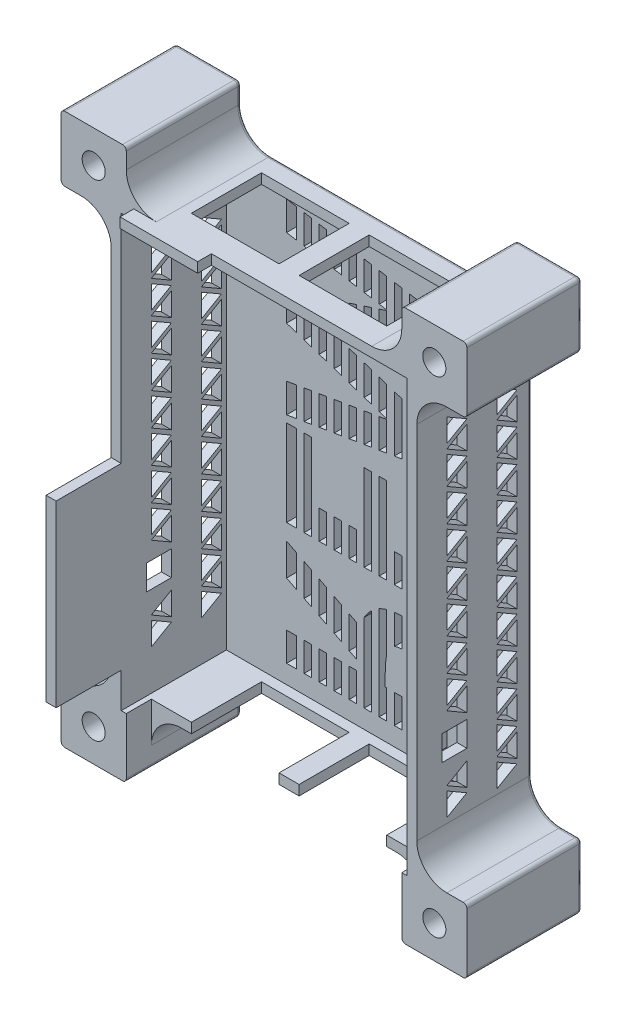
from build123d import *

# Parameters (mm, degrees)
SKETCH1_W            = 61
SKETCH1_H            = 90
BOSS_EXTRUDE1_DEPTH  = 4
SKETCH2_W            = 57
SKETCH2_H            = 86
CUT_EXTRUDE1_DEPTH   = 2
SKETCH3_W            = 61
SKETCH3_H            = 90
SKETCH3_W_2          = 57
SKETCH3_H_2          = 86
BOSS_EXTRUDE2_DEPTH  = 14
BOSS_EXTRUDE3_DEPTH  = 5
SKETCH5_W            = 17.5
SKETCH5_H            = 14
CUT_EXTRUDE2_DEPTH   = 5
SKETCH6_W            = 17.5
SKETCH6_H            = 14
CUT_EXTRUDE3_DEPTH   = 5
SKETCH7_W            = 2
SKETCH7_H            = 35.75
BOSS_EXTRUDE4_DEPTH  = 13
SKETCH8_W            = 5
SKETCH8_H            = 5
CUT_EXTRUDE4_DEPTH   = 115.529472189
CUT_EXTRUDE5_DEPTH   = 2
SKETCH16_W           = 15.5
SKETCH16_H           = 2
BOSS_EXTRUDE9_DEPTH  = 2.75
SKETCH22_W           = 1.5
SKETCH22_H           = 90
BOSS_EXTRUDE11_DEPTH = 2
FILLET5_R            = 0.75
BOSS_EXTRUDE13_START = -23
SKETCH36_W           = 13
SKETCH36_H           = 13
BOSS_EXTRUDE13_DEPTH = 23
SKETCH37_W           = 13
SKETCH37_H           = 13
BOSS_EXTRUDE14_DEPTH = 23
SKETCH41_W           = 1
SKETCH41_H           = 1
CUT_EXTRUDE13_DEPTH  = 21
SKETCH49_W           = 57.25
SKETCH49_H           = 0.75
BOSS_EXTRUDE15_DEPTH = 1
FILLET8_R            = 6
FILLET9_R            = 6
FILLET10_R           = 6
FILLET11_R           = 6
SKETCH46_R           = 2.3
CUT_EXTRUDE18_DEPTH  = 128.816274528
SKETCH50_W           = 5.5
SKETCH50_H           = 2.75
CUT_EXTRUDE19_DEPTH  = 128.816274528
BOSS_EXTRUDE16_DEPTH = 23
SKETCH52_R           = 2.3
CUT_EXTRUDE20_DEPTH  = 128.816274528
FILLET13_R           = 6
FILLET14_R           = 6
FILLET15_R           = 6
FILLET16_R           = 6
FILLET18_R           = 0.75


with BuildPart() as part:
    # Sketch1 → Boss-Extrude1 (new body)
    with BuildSketch(Plane.XY):
        with Locations((30.5, 45)):
            Rectangle(SKETCH1_W, SKETCH1_H)
    extrude(amount=BOSS_EXTRUDE1_DEPTH)

    # Sketch2 → Cut-Extrude1 (cut)
    with BuildSketch(Plane.XY.offset(4)):
        with Locations((30.5, 45)):
            Rectangle(SKETCH2_W, SKETCH2_H)
    extrude(amount=-CUT_EXTRUDE1_DEPTH, mode=Mode.SUBTRACT)

    # Sketch3 → Boss-Extrude2 (add)
    with BuildSketch(Plane.XY.offset(4)):
        with Locations((30.5, 45)):
            Rectangle(SKETCH3_W, SKETCH3_H)
        with Locations((30.5, 45)):
            Rectangle(SKETCH3_W_2, SKETCH3_H_2, mode=Mode.SUBTRACT)
    extrude(amount=BOSS_EXTRUDE2_DEPTH)

    # Sketch4 → Boss-Extrude3 (add)
    with BuildSketch(Plane.XY.offset(18)):
        Polygon((2, 2), (2, 88), (59, 88), (59, 2), (61, 2), (61, 90), (0, 90), (0, 2), align=None)
    extrude(amount=BOSS_EXTRUDE3_DEPTH)

    # Sketch5 → Cut-Extrude2 (cut)
    with BuildSketch(Plane(origin=(0, 0, 0), x_dir=(-1, 0, 0), z_dir=(0, -1, 0))):
        with Locations((-19.75, -11)):
            Rectangle(SKETCH5_W, SKETCH5_H)
        with Locations((-41.25, -11)):
            Rectangle(SKETCH5_W, SKETCH5_H)
    extrude(amount=-CUT_EXTRUDE2_DEPTH, mode=Mode.SUBTRACT)

    # Sketch6 → Cut-Extrude3 (cut)
    with BuildSketch(Plane(origin=(0, 90, 0), x_dir=(1, 0, 0), z_dir=(0, 1, 0))):
        with Locations((41.25, -11)):
            Rectangle(SKETCH6_W, SKETCH6_H)
        with Locations((19.75, -11)):
            Rectangle(SKETCH6_W, SKETCH6_H)
    extrude(amount=-CUT_EXTRUDE3_DEPTH, mode=Mode.SUBTRACT)

    # Sketch7 → Boss-Extrude4 (add)
    with BuildSketch(Plane.XY.offset(23)):
        with Locations((1, 26.875)):
            Rectangle(SKETCH7_W, SKETCH7_H)
    extrude(amount=BOSS_EXTRUDE4_DEPTH)

    # Sketch8 → Cut-Extrude4 (cut, through all)
    with BuildSketch(Plane(origin=(61, 0, 0), x_dir=(0, 0, -1), z_dir=(1, 0, 0))):
        Polygon((-13, 17.85196366), (-13, 13.233161507), (-17, 15.542562584), align=None)
        with Locations((-15.5, 22.5)):
            Rectangle(SKETCH8_W, SKETCH8_H)
        Polygon((-3, 12.309401077), (-7, 10), (-7, 14.618802154), align=None)
        Polygon((-3, 13.233161507), (-7, 15.542562584), (-3, 17.85196366), align=None)
        Polygon((-17, 14.618802154), (-13, 12.309401077), (-17, 10), align=None)
        Polygon((-13, 30.784609687), (-13, 26.165807534), (-17, 28.475208611), align=None)
        Polygon((-13, 37.250932701), (-13, 32.632130547), (-17, 34.941531624), align=None)
        Polygon((-17, 34.017771194), (-13, 31.708370117), (-17, 29.398969041), align=None)
        Polygon((-13, 43.717255714), (-13, 39.098453561), (-17, 41.407854638), align=None)
        Polygon((-17, 40.484094208), (-13, 38.174693131), (-17, 35.865292054), align=None)
        Polygon((-13, 50.183578728), (-13, 45.564776574), (-17, 47.874177651), align=None)
        Polygon((-17, 46.950417221), (-13, 44.641016144), (-17, 42.331615068), align=None)
        Polygon((-13, 56.649901741), (-13, 52.031099588), (-17, 54.340500665), align=None)
        Polygon((-17, 53.416740235), (-13, 51.107339158), (-17, 48.797938081), align=None)
        Polygon((-13, 63.116224755), (-13, 58.497422601), (-17, 60.806823678), align=None)
        Polygon((-17, 59.883063248), (-13, 57.573662171), (-17, 55.264261095), align=None)
        Polygon((-13, 69.582547768), (-13, 64.963745615), (-17, 67.273146692), align=None)
        Polygon((-17, 66.349386262), (-13, 64.039985185), (-17, 61.730584108), align=None)
        Polygon((-13, 76.048870782), (-13, 71.430068628), (-17, 73.739469705), align=None)
        Polygon((-17, 72.815709275), (-13, 70.506308198), (-17, 68.196907122), align=None)
        Polygon((-17, 79.282032289), (-13, 76.972631212), (-17, 74.663230135), align=None)
        Polygon((-3, 24.318286674), (-3, 19.69948452), (-7, 22.008885597), align=None)
        Polygon((-7, 21.085125167), (-3, 18.77572409), (-7, 16.466323014), align=None)
        Polygon((-3, 30.784609687), (-3, 26.165807534), (-7, 28.475208611), align=None)
        Polygon((-7, 27.551448181), (-3, 25.242047104), (-7, 22.932646027), align=None)
        Polygon((-3, 37.250932701), (-3, 32.632130547), (-7, 34.941531624), align=None)
        Polygon((-7, 34.017771194), (-3, 31.708370117), (-7, 29.398969041), align=None)
        Polygon((-3, 43.717255714), (-3, 39.098453561), (-7, 41.407854638), align=None)
        Polygon((-7, 40.484094208), (-3, 38.174693131), (-7, 35.865292054), align=None)
        Polygon((-3, 50.183578728), (-3, 45.564776574), (-7, 47.874177651), align=None)
        Polygon((-7, 46.950417221), (-3, 44.641016144), (-7, 42.331615068), align=None)
        Polygon((-3, 56.649901741), (-3, 52.031099588), (-7, 54.340500665), align=None)
        Polygon((-7, 53.416740235), (-3, 51.107339158), (-7, 48.797938081), align=None)
        Polygon((-3, 63.116224755), (-3, 58.497422601), (-7, 60.806823678), align=None)
        Polygon((-7, 59.883063248), (-3, 57.573662171), (-7, 55.264261095), align=None)
        Polygon((-3, 69.582547768), (-3, 64.963745615), (-7, 67.273146692), align=None)
        Polygon((-7, 66.349386262), (-3, 64.039985185), (-7, 61.730584108), align=None)
        Polygon((-3, 76.048870782), (-3, 71.430068628), (-7, 73.739469705), align=None)
        Polygon((-7, 72.815709275), (-3, 70.506308198), (-7, 68.196907122), align=None)
        Polygon((-7, 79.282032289), (-3, 76.972631212), (-7, 74.663230135), align=None)
    extrude(amount=-CUT_EXTRUDE4_DEPTH, mode=Mode.SUBTRACT)

    # Sketch9 → Cut-Extrude5 (cut)
    # profile 1 of 3: a face of its own
    with BuildSketch(Plane(origin=(-13.266512167, 62.494438007, 0), x_dir=(0, 1, 0), z_dir=(0, 0, -1))):
        with BuildLine():
            Line((-56.802130315, 59.266512167), (-50.109822622, 59.266512167))
            add(Edge.make_bspline(
                [(-50.109822622, 59.266512167), (-49.667463121, 59.264942045), (-48.816681194, 59.261922257), (-47.589900124, 59.214278008), (-46.462933001, 59.147977126), (-45.434111249, 59.046800219), (-44.503875014, 58.912651871), (-43.671291982, 58.754513167), (-42.93638649, 58.574280209), (-42.292960623, 58.349695725), (-41.712300595, 58.096367831), (-41.171044722, 57.805289436), (-40.657252094, 57.479701789), (-40.17435686, 57.111037799), (-39.718162547, 56.70592964), (-39.287808517, 56.26396953), (-38.889376072, 55.78140983), (-38.52533232, 55.261299705), (-38.193535744, 54.71415578), (-37.900297161, 54.139226823), (-37.661835058, 53.53611301), (-37.451128227, 52.913530638), (-37.299362923, 52.262579771), (-37.193812374, 51.589597526), (-37.116532391, 50.892214933), (-37.112089162, 50.418444162), (-37.109822622, 50.176768577)],
                knots=[0, 0, 0, 0, 1.749336639, 3.364467119, 4.854658419, 6.213483162, 7.451590619, 8.570285859, 9.5643256, 10.440900261, 11.26203566, 12.067320669, 12.869050712, 13.665104639, 14.467235401, 15.27997916, 16.102287765, 16.939272006, 17.78853747, 18.631303466, 19.488103222, 20.351255419, 21.228522269, 22.127379805, 23.044756219, 24, 24, 24, 24], degree=3))
            add(Edge.make_bspline(
                [(-37.109822622, 50.176768577), (-37.115710277, 49.924514784), (-37.127254893, 49.429891072), (-37.18944048, 48.70332918), (-37.303096198, 48.008205583), (-37.475244317, 47.346555516), (-37.673106221, 46.710143974), (-37.936211798, 46.110713148), (-38.233152446, 45.539545183), (-38.585820178, 45.004719469), (-38.972855785, 44.494356457), (-39.422970054, 44.028010047), (-39.907002495, 43.580615886), (-40.452162334, 43.180197226), (-41.034418419, 42.799679204), (-41.665339566, 42.45482854), (-42.340808166, 42.136976483), (-42.815696044, 41.95972022), (-43.058540571, 41.869076269)],
                knots=[0, 0, 0, 0, 1.099860209, 2.156625411, 3.176576793, 4.16617041, 5.135385252, 6.078461593, 7.016046972, 7.938469504, 8.868247731, 9.803980173, 10.76021508, 11.73834243, 12.748633912, 13.790971185, 14.870363756, 16, 16, 16, 16], degree=3))
            Line((-43.058540571, 41.869076269), (-35.673925186, 27.266512167))
            Line((-35.673925186, 27.266512167), (-42.058540571, 27.266512167))
            Line((-42.058540571, 27.266512167), (-49.109822622, 41.215230116))
            Line((-49.109822622, 41.215230116), (-51.058540571, 41.215230116))
            Line((-51.058540571, 41.215230116), (-51.058540571, 27.266512167))
            Line((-51.058540571, 27.266512167), (-56.802130315, 27.266512167))
            Line((-56.802130315, 27.266512167), (-56.802130315, 59.266512167))
        make_face()
        with BuildLine():
            Line((-51.058540571, 46.958819859), (-48.821361084, 46.958819859))
            add(Edge.make_bspline(
                [(-48.821361084, 46.958819859), (-48.547847295, 46.961900355), (-48.02412716, 46.967798843), (-47.27094882, 46.995158476), (-46.586883264, 47.061081673), (-45.968992883, 47.144373167), (-45.414168509, 47.240545226), (-44.927358981, 47.378365626), (-44.501063305, 47.526043673), (-44.140333102, 47.709569177), (-43.832133506, 47.918277481), (-43.56602288, 48.155375302), (-43.345911237, 48.429785839), (-43.164748128, 48.734051799), (-43.023822925, 49.070864337), (-42.920958323, 49.436526017), (-42.863472222, 49.835202194), (-42.856858251, 50.110343042), (-42.853412366, 50.253691654)],
                knots=[0, 0, 0, 0, 1.688639943, 3.233382647, 4.650958383, 5.928841754, 7.082724185, 8.122798841, 9.049171256, 9.863274652, 10.613301712, 11.341792392, 12.054588806, 12.776240173, 13.521029143, 14.301969904, 15.115324896, 16, 16, 16, 16], degree=3))
            add(Edge.make_bspline(
                [(-42.853412366, 50.253691654), (-42.859927127, 50.423283527), (-42.872724168, 50.756415335), (-42.999710567, 51.236008328), (-43.201845485, 51.679904456), (-43.478917095, 52.086098086), (-43.827852765, 52.442195463), (-44.228283977, 52.756098136), (-44.688853003, 53.004308883), (-45.115305262, 53.168026048), (-45.503277138, 53.265979718), (-45.853409516, 53.338973926), (-46.258864918, 53.390707016), (-46.719949441, 53.445579167), (-47.235487763, 53.481160979), (-47.808289878, 53.50712861), (-48.436710703, 53.517753243), (-48.874779702, 53.521149751), (-49.103412366, 53.522922423)],
                knots=[0, 0, 0, 0, 1.020303359, 2.004196876, 2.966617323, 3.9489082, 4.950758222, 5.960522915, 7.003732012, 8.091992268, 8.70421221, 9.413913587, 10.24622431, 11.166358409, 12.212345909, 13.359657661, 14.621978493, 16, 16, 16, 16], degree=3))
            Line((-49.103412366, 53.522922423), (-51.058540571, 53.522922423))
            Line((-51.058540571, 53.522922423), (-51.058540571, 46.958819859))
        make_face(mode=Mode.SUBTRACT)
    # profile 2 of 3: a face of its own
    with BuildSketch(Plane(origin=(-13.266512167, 62.494438007, 0), x_dir=(0, 1, 0), z_dir=(0, 0, -1))):
        Polygon((-32.453412366, 59.266512167), (-15.222643135, 59.266512167), (-15.222643135, 53.522922423), (-26.709822622, 53.522922423), (-26.709822622, 47.369076269), (-15.222643135, 47.369076269), (-15.222643135, 41.625486526), (-26.709822622, 41.625486526), (-26.709822622, 33.01010191), (-15.222643135, 33.01010191), (-15.222643135, 27.266512167), (-32.453412366, 27.266512167), align=None)
    # profile 3 of 3: a face of its own
    with BuildSketch(Plane(origin=(-13.266512167, 62.494438007, 0), x_dir=(0, 1, 0), z_dir=(0, 0, -1))):
        Polygon((-8.444438007, 59.266512167), (-2.495720058, 59.266512167), (4.818382506, 36.945999346), (12.170946608, 59.266512167), (18.074792762, 59.266512167), (23.485049173, 27.266512167), (17.670946608, 27.266512167), (14.254279942, 47.478050628), (7.600433788, 27.266512167), (2.004279942, 27.266512167), (-4.61751493, 47.478050628), (-8.02777134, 27.266512167), (-13.848284161, 27.266512167), align=None)
    extrude(amount=-CUT_EXTRUDE5_DEPTH, mode=Mode.SUBTRACT)


with BuildPart() as cut_extrude5_piece_1:
    # of the separate pieces the step leaves, piece 1, a body of its own (cut_extrude5_pieces)
    add(part.part.solids().sort_by_distance((0, 0, 18))[0])

    # Sketch16 → Boss-Extrude9 (add)
    with BuildSketch(Plane.XY.offset(23)):
        with Locations((12.25, 89)):
            Rectangle(SKETCH16_W, SKETCH16_H)
    extrude(amount=BOSS_EXTRUDE9_DEPTH)



with BuildPart() as cut_extrude5_piece_2:
    # of the separate pieces the step leaves, piece 2, a body of its own (cut_extrude5_pieces)
    add(part.part.solids().sort_by_distance((33.692307692, 11.435897436, 0))[0])


with BuildPart() as cut_extrude5_piece_1_1:
    add(cut_extrude5_piece_1.part)

    add(cut_extrude5_piece_2.part)  # Boss-Extrude11 merges Cut-Extrude5 piece 2
    # Sketch22 → Boss-Extrude11 (add)
    with BuildSketch(Plane(origin=(0, 0, 0), x_dir=(-1, 0, 0), z_dir=(0, 0, -1))):
        with Locations((-25.75, 45)):
            Rectangle(SKETCH22_W, SKETCH22_H)
        with Locations((-28.75, 45)):
            Rectangle(SKETCH22_W, SKETCH22_H)
        with Locations((-22.75, 45)):
            Rectangle(SKETCH22_W, SKETCH22_H)
        with Locations((-19.75, 45)):
            Rectangle(SKETCH22_W, SKETCH22_H)
        with Locations((-16.75, 45)):
            Rectangle(SKETCH22_W, SKETCH22_H)
        with Locations((-31.75, 45)):
            Rectangle(SKETCH22_W, SKETCH22_H)
        with Locations((-34.75, 45)):
            Rectangle(SKETCH22_W, SKETCH22_H)
        with Locations((-37.75, 45)):
            Rectangle(SKETCH22_W, SKETCH22_H)
        with Locations((-40.75, 45)):
            Rectangle(SKETCH22_W, SKETCH22_H)
        with Locations((-43.75, 45)):
            Rectangle(SKETCH22_W, SKETCH22_H)
        with Locations((-46.75, 45)):
            Rectangle(SKETCH22_W, SKETCH22_H)
        with Locations((-49.75, 45)):
            Rectangle(SKETCH22_W, SKETCH22_H)
    extrude(amount=-BOSS_EXTRUDE11_DEPTH)

    # Fillet5
    fillet5_edges = [cut_extrude5_piece_1_1.edges().sort_by_distance(p)[0] for p in [
        (30.5, 0, 0),
        (30.5, 90, 0),
        (0, 0, 9),
        (61, 90, 11.5),
        (61, 45, 0),
        (61, 0, 9),
        (0, 45, 0),
        (0, 90, 11.5),
    ]]
    fillet(fillet5_edges, radius=FILLET5_R)

    # Sketch36 → Boss-Extrude13 (add)
    with BuildSketch(Plane(origin=(0, 0, 0), x_dir=(-1, 0, 0), z_dir=(0, 0, -1)).offset(BOSS_EXTRUDE13_START)):
        with Locations((-64.5, -3.5)):
            Rectangle(SKETCH36_W, SKETCH36_H)
    extrude(amount=BOSS_EXTRUDE13_DEPTH)

    # Sketch37 → Boss-Extrude14 (add)
    with BuildSketch(Plane(origin=(0, 0, 0), x_dir=(-1, 0, 0), z_dir=(0, 0, -1))):
        with Locations((3.5, 93.5)):
            Rectangle(SKETCH37_W, SKETCH37_H)
    extrude(amount=-BOSS_EXTRUDE14_DEPTH)

    # Sketch41 → Cut-Extrude13 (cut)
    with BuildSketch(Plane.XY.offset(23)):
        with Locations((58.5, 2.5)):
            Rectangle(SKETCH41_W, SKETCH41_H)
        with Locations((2.5, 87.5)):
            Rectangle(SKETCH41_W, SKETCH41_H)
    extrude(amount=-CUT_EXTRUDE13_DEPTH, mode=Mode.SUBTRACT)

    # Sketch49 → Boss-Extrude15 (add)
    with BuildSketch(Plane(origin=(0, 0, 0), x_dir=(-1, 0, 0), z_dir=(0, 0, -1))):
        Polygon((-61, 90), (-61, 3), (-60.25, 3), (-60.25, 89.25), (-60.25, 90), align=None)
        with Locations((-31.625, 89.625)):
            Rectangle(SKETCH49_W, SKETCH49_H)
        Polygon((0, 87), (-0.75, 87), (-0.75, 0.75), (-0.75, 0), (0, 0), align=None)
        with Locations((-29.375, 0.375)):
            Rectangle(SKETCH49_W, SKETCH49_H)
    extrude(amount=-BOSS_EXTRUDE15_DEPTH)

    # Fillet8
    fillet8_edges = [cut_extrude5_piece_1_1.edges().sort_by_distance(p)[0] for p in [
        (61, 3, 11.5),
    ]]
    fillet(fillet8_edges, radius=FILLET8_R)

    # Fillet9
    fillet9_edges = [cut_extrude5_piece_1_1.edges().sort_by_distance(p)[0] for p in [
        (58, 0, 9),
    ]]
    fillet(fillet9_edges, radius=FILLET9_R)

    # Fillet10
    fillet10_edges = [cut_extrude5_piece_1_1.edges().sort_by_distance(p)[0] for p in [
        (3, 90, 11.5),
    ]]
    fillet(fillet10_edges, radius=FILLET10_R)

    # Fillet11
    fillet11_edges = [cut_extrude5_piece_1_1.edges().sort_by_distance(p)[0] for p in [
        (0, 87, 11.5),
    ]]
    fillet(fillet11_edges, radius=FILLET11_R)

    # Sketch46 → Cut-Extrude18 (cut, through all)
    with BuildSketch(Plane(origin=(0, 0, 0), x_dir=(-1, 0, 0), z_dir=(0, 0, -1))):
        with Locations((-64.5, -3.5)):
            Circle(SKETCH46_R)
        with Locations((3.5, 93.5)):
            Circle(SKETCH46_R)
    extrude(amount=-CUT_EXTRUDE18_DEPTH, mode=Mode.SUBTRACT)

    # Sketch50 → Cut-Extrude19 (cut, through all)
    with BuildSketch(Plane(origin=(0, 90, 0), x_dir=(1, 0, 0), z_dir=(0, 1, 0))):
        with Locations((7.25, -24.375)):
            Rectangle(SKETCH50_W, SKETCH50_H)
    extrude(amount=CUT_EXTRUDE19_DEPTH, mode=Mode.SUBTRACT)

    # Sketch51 → Boss-Extrude16 (add)
    with BuildSketch(Plane.XY.offset(23)):
        Polygon((-10, -10), (3, -10), (3, 2), (2, 2), (2, 3), (-10, 3), align=None)
        Polygon((59, 87), (71, 87), (71, 100), (58, 100), (58, 88), (59, 88), align=None)
    extrude(amount=-BOSS_EXTRUDE16_DEPTH)

    # Sketch52 → Cut-Extrude20 (cut, through all)
    with BuildSketch(Plane(origin=(0, 0, 0), x_dir=(-1, 0, 0), z_dir=(0, 0, -1))):
        with Locations((-64.5, 93.5)):
            Circle(SKETCH52_R)
        with Locations((3.5, -3.5)):
            Circle(SKETCH52_R)
    extrude(amount=-CUT_EXTRUDE20_DEPTH, mode=Mode.SUBTRACT)

    # Fillet13
    fillet13_edges = [cut_extrude5_piece_1_1.edges().sort_by_distance(p)[0] for p in [
        (58, 90, 11.5),
    ]]
    fillet(fillet13_edges, radius=FILLET13_R)

    # Fillet14
    fillet14_edges = [cut_extrude5_piece_1_1.edges().sort_by_distance(p)[0] for p in [
        (61, 87, 11.5),
    ]]
    fillet(fillet14_edges, radius=FILLET14_R)

    # Fillet15
    fillet15_edges = [cut_extrude5_piece_1_1.edges().sort_by_distance(p)[0] for p in [
        (3, 0, 9),
    ]]
    fillet(fillet15_edges, radius=FILLET15_R)

    # Fillet16
    fillet16_edges = [cut_extrude5_piece_1_1.edges().sort_by_distance(p)[0] for p in [
        (0, 3, 11.5),
    ]]
    fillet(fillet16_edges, radius=FILLET16_R)

    # Fillet18
    fillet18_edges = [cut_extrude5_piece_1_1.edges().sort_by_distance(p)[0] for p in [
        (71, 3, 11.5),
        (71, -3.5, 0),
        (64.5, -10, 0),
        (58, -8, 0),
        (71, -10, 11.5),
        (58, -10, 11.5),
        (-10, 87, 11.5),
        (-10, 93.5, 0),
        (-3.5, 100, 0),
        (3, 98, 0),
        (-10, 100, 11.5),
        (3, 100, 11.5),
        (61, 45, 0),
        (69, 3, 0),
        (62.757359313, 4.757359313, 0),
        (56.242640687, -1.757359313, 0),
        (4.757359313, 91.757359313, 0),
        (0, 45, 0),
        (-8, 87, 0),
        (-1.757359313, 85.242640687, 0),
        (-10, 3, 11.5),
        (-10, -3.5, 0),
        (-8, 3, 0),
        (-3.5, -10, 0),
        (3, -10, 11.5),
        (3, -8, 0),
        (-10, -10, 11.5),
        (71, 87, 11.5),
        (64.5, 100, 0),
        (71, 93.5, 0),
        (71, 100, 11.5),
        (58, 100, 11.5),
        (58, 98, 0),
        (30.5, 90, 0),
        (56.242640687, 91.757359313, 0),
        (69, 87, 0),
        (62.757359313, 85.242640687, 0),
        (30.5, 0, 0),
        (4.757359313, -1.757359313, 0),
        (-1.757359313, 4.757359313, 0),
    ]]
    fillet(fillet18_edges, radius=FILLET18_R)


solid = cut_extrude5_piece_1_1.part
